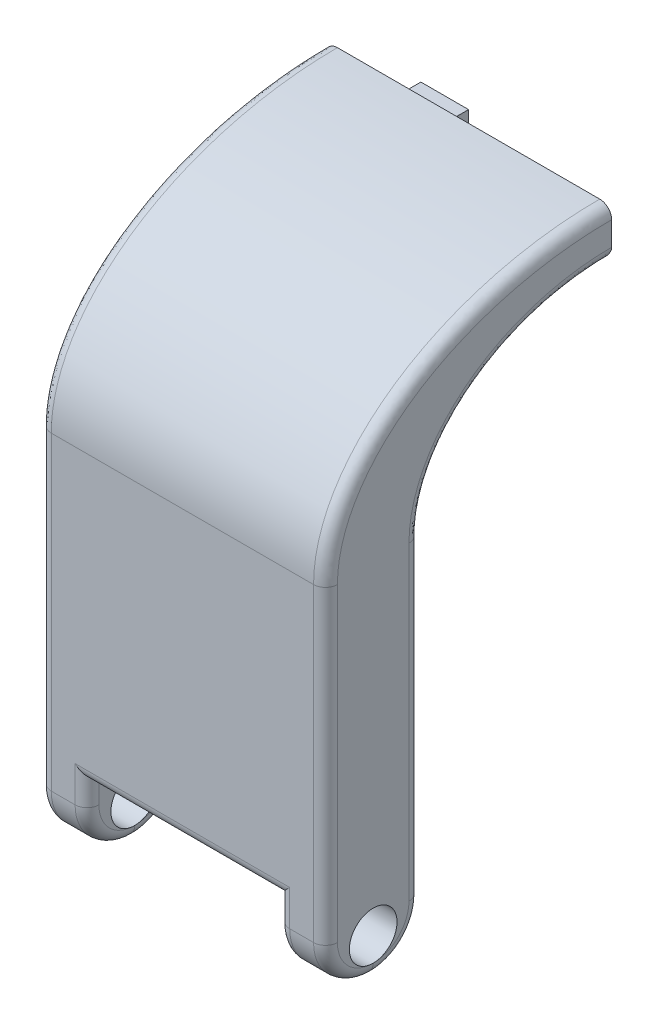
from build123d import *

# Parameters (mm, degrees)
SKETCH1_W               = 60
SKETCH1_H               = 20
BOSS_EXTRUDE1_DEPTH     = 30
SKETCH2_W               = 40
SKETCH2_H               = 20
CUT_EXTRUDE1_DEPTH      = 15
CUT_EXTRUDE2_DEPTH      = 62.64414003
CUT_EXTRUDE2_DEPTH_BACK = 62.64414003
SKETCH3_R               = 5
SKETCH5_W               = 60
SKETCH5_H               = 20
BOSS_EXTRUDE2_DEPTH     = 45
BOSS_EXTRUDE3_DEPTH     = 60
SKETCH8_W               = 10
SKETCH8_H               = 5
BOSS_EXTRUDE5_DEPTH     = 5
FILLET1_R               = 10
FILLET2_R               = 2.5


with BuildPart() as part:
    # Sketch1 → Boss-Extrude1 (new body)
    with BuildSketch(Plane(origin=(0, 0, 0), x_dir=(1, 0, 0), z_dir=(0, 1, 0))):
        with Locations((30, -10)):
            Rectangle(SKETCH1_W, SKETCH1_H)
    extrude(amount=-BOSS_EXTRUDE1_DEPTH)

    # Sketch2 → Cut-Extrude1 (cut)
    with BuildSketch(Plane.XZ.offset(30)):
        with Locations((30, 10)):
            Rectangle(SKETCH2_W, SKETCH2_H)
    extrude(amount=-CUT_EXTRUDE1_DEPTH, mode=Mode.SUBTRACT)

    # Sketch3 → Cut-Extrude2 (cut, two sides: drawn at the far end of the back side and taken through both)
    with BuildSketch(Plane(origin=(10, 0, 0), x_dir=(0, 0, -1), z_dir=(1, 0, 0)).offset(-CUT_EXTRUDE2_DEPTH_BACK)):
        with Locations((-10, -22.5)):
            Circle(SKETCH3_R)
    extrude(amount=CUT_EXTRUDE2_DEPTH + CUT_EXTRUDE2_DEPTH_BACK, mode=Mode.SUBTRACT)

    # Sketch5 → Boss-Extrude2 (add)
    with BuildSketch(Plane(origin=(0, 0, 0), x_dir=(1, 0, 0), z_dir=(0, 1, 0))):
        with Locations((30, -10)):
            Rectangle(SKETCH5_W, SKETCH5_H)
    extrude(amount=BOSS_EXTRUDE2_DEPTH)

    # Sketch6 → Boss-Extrude3 (add)
    with BuildSketch(Plane(origin=(0, 0, 0), x_dir=(0, 0, -1), z_dir=(1, 0, 0))):
        with BuildLine():
            Line((40, 85), (40, 75))
            add(Edge.make_bspline(
                [(40, 75), (0, 75), (0, 45)],
                knots=[4.71238898, 4.71238898, 4.71238898, 6.283185307, 6.283185307, 6.283185307], degree=2, weights=[1, 0.707106781, 1]))
            Line((0, 45), (-20, 45))
            add(Edge.make_bspline(
                [(40, 85), (-20, 85), (-20, 45)],
                knots=[1.570796327, 1.570796327, 1.570796327, 3.141592654, 3.141592654, 3.141592654], degree=2, weights=[1, 0.707106781, 1]))
        make_face()
    extrude(amount=BOSS_EXTRUDE3_DEPTH)

    # Sketch8 → Boss-Extrude5 (add)
    with BuildSketch(Plane(origin=(0, 0, -40), x_dir=(-1, 0, 0), z_dir=(0, 0, -1))):
        with Locations((-20, 80)):
            Rectangle(SKETCH8_W, SKETCH8_H)
    extrude(amount=BOSS_EXTRUDE5_DEPTH)

    # Fillet1
    fillet1_edges = [part.edges().sort_by_distance(p)[0] for p in [
        (5, -30, 20),
        (5, -30, 0),
        (55, -30, 20),
        (55, -30, 0),
    ]]
    fillet(fillet1_edges, radius=FILLET1_R - 0.0001)  # a hair under: the kernel refuses the full size

    # Fillet2
    fillet2_edges = [part.edges().sort_by_distance(p)[0] for p in [
        (10, -17.50005, 0),
        (30, -15, 20),
        (10, -17.50005, 20),
        (50, -17.50005, 20),
        (30, -15, 0),
        (50, -17.50005, 0),
        (0, 66.213203436, -11.715728753),
        (30, 75, -40),
        (0, 73.284271247, 2.426406871),
        (60, 66.213203436, -11.715728753),
        (60, 73.284271247, 2.426406871),
        (15, 77.5, -42.5),
        (25, 77.5, -42.5),
        (20, 77.5, -45),
        (60, 12.49995, 20),
        (0, 12.49995, 20),
        (10, -27.071097101, 2.928902899),
        (10, -27.071097101, 17.071097101),
        (0, 12.49995, 0),
        (0, -27.071097101, 2.928902899),
        (0, -27.071097101, 17.071097101),
        (60, 12.49995, 0),
        (60, -27.071097101, 2.928902899),
        (60, -27.071097101, 17.071097101),
        (50, -27.071097101, 2.928902899),
        (50, -27.071097101, 17.071097101),
    ]]
    fillet(fillet2_edges, radius=FILLET2_R - 0.0001)  # a hair under: the kernel refuses the full size


solid = part.part
